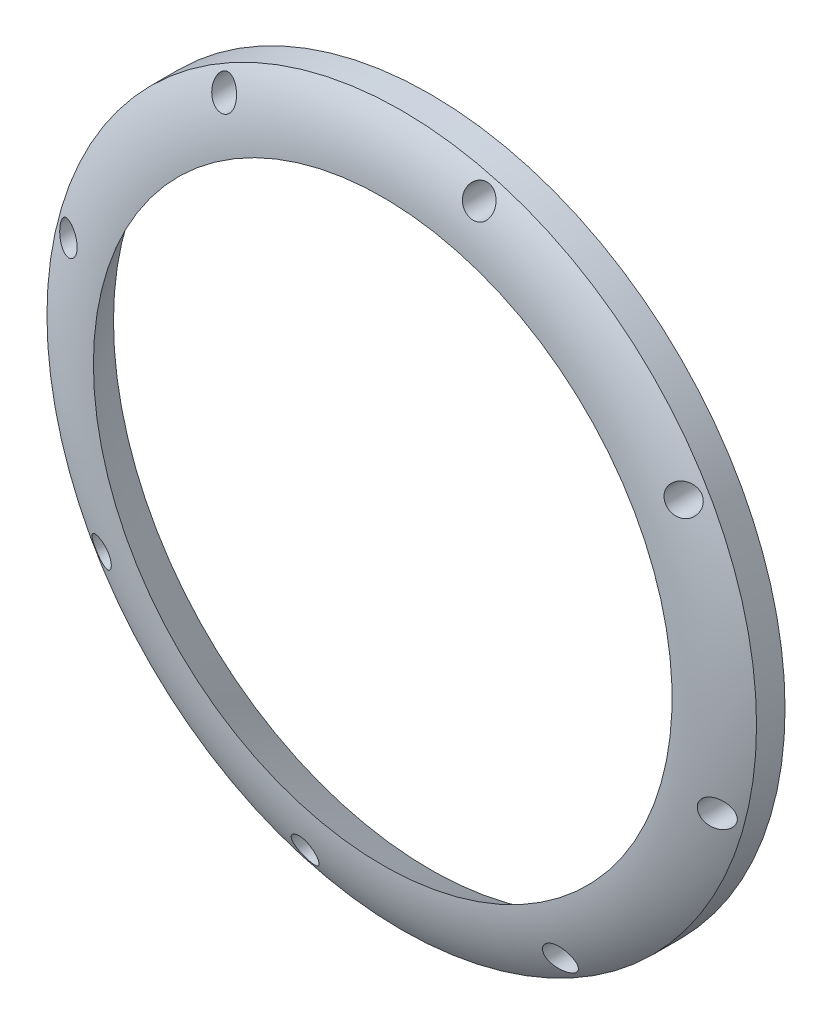
from build123d import *

# Parameters (mm, degrees)
SKETCH3_R          = 2.65
CUT_EXTRUDE1_DEPTH = 160.100597108
CUT_EXTRUDE2_START = -3
SKETCH4_R          = 4.5
CUT_EXTRUDE2_DEPTH = 157.100597258
CIRPATTERN1_COUNT  = 8


with BuildPart() as part:
    # Sketch2 → Revolve1 (revolve)
    with BuildSketch(Plane(origin=(0, 0, 0), x_dir=(1, 0, 0), z_dir=(0, 1, 0))):
        with BuildLine():
            Line((-100, 0), (-112, 0))
            Line((-112, 0), (-112, -9))
            ThreePointArc((-112, -9), (-102.096675088, -13.469639994), (-91.339745962, -15))
            Line((-91.339745962, -15), (-100, 0))
        make_face()
    revolve(axis=Axis((0, 0, 0), (0, 0, 1)))

    # Sketch3 → Cut-Extrude1 (cut, through all)
    with BuildSketch(Plane(origin=(0, 0, 0), x_dir=(-1, 0, 0), z_dir=(0, 0, -1))):
        with Locations((-102.388137587, -27.434818781)):
            Circle(SKETCH3_R)
    cut_extrude1 = extrude(amount=-CUT_EXTRUDE1_DEPTH, mode=Mode.SUBTRACT)

    # Sketch4 → Cut-Extrude2 (cut, through all)
    with BuildSketch(Plane(origin=(0, 0, 0), x_dir=(-1, 0, 0), z_dir=(0, 0, -1)).offset(CUT_EXTRUDE2_START)):
        with Locations((-102.388137587, -27.434818781)):
            Circle(SKETCH4_R)
    cut_extrude2 = extrude(amount=-CUT_EXTRUDE2_DEPTH, mode=Mode.SUBTRACT)

    # CirPattern1: Cut-Extrude1, Cut-Extrude2 ×8 about axis
    cirpattern1_axis = Axis((0, 0, 0), (0, 0, -1))
    add([cut_extrude1.rotate(cirpattern1_axis, i * 360 / CIRPATTERN1_COUNT) for i in range(1, CIRPATTERN1_COUNT)], mode=Mode.SUBTRACT)
    add([cut_extrude2.rotate(cirpattern1_axis, i * 360 / CIRPATTERN1_COUNT) for i in range(1, CIRPATTERN1_COUNT)], mode=Mode.SUBTRACT)


solid = part.part
